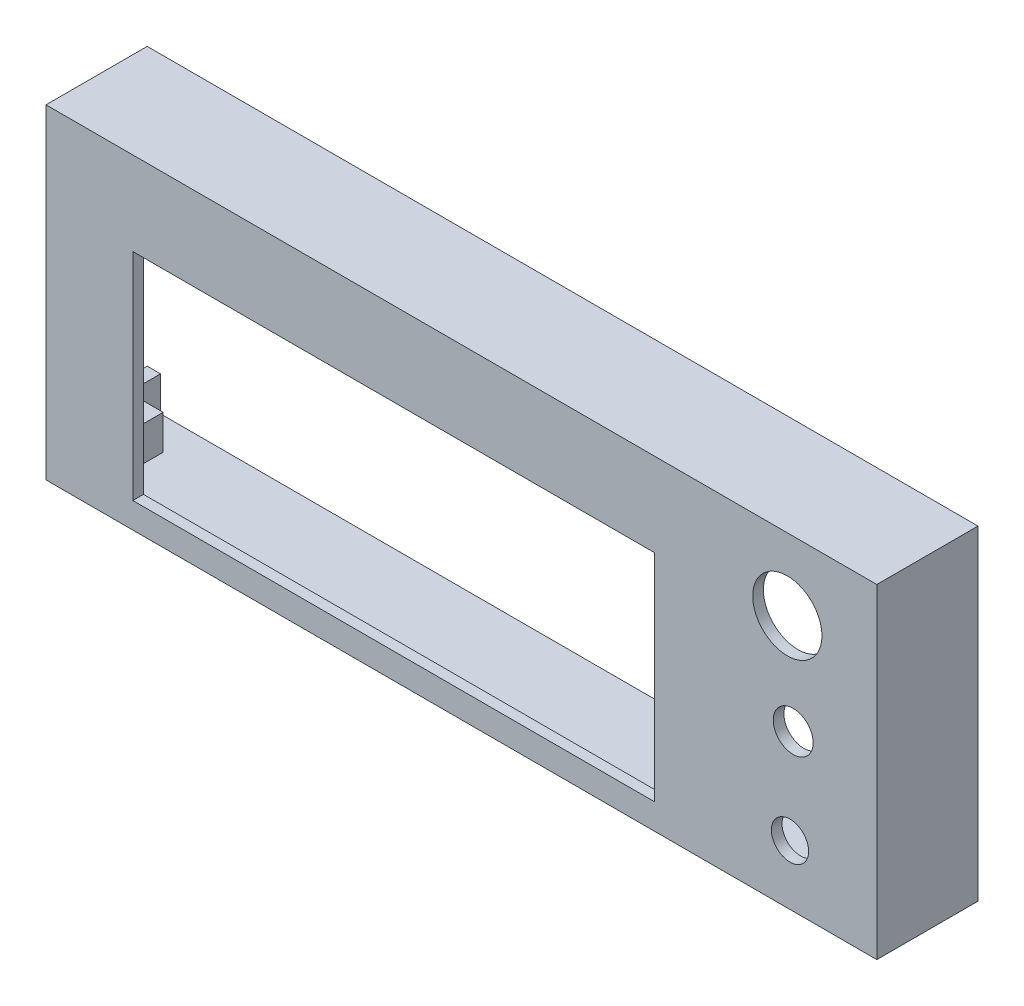
from build123d import *

# Parameters (mm, degrees)
BOSS_EXTRUDE1_DEPTH                                 = 24
SKETCH2_W                                           = 151
SKETCH2_H                                           = 56
CUT_EXTRUDE1_DEPTH                                  = 22
SKETCH3_W                                           = 156
SKETCH3_H                                           = 61
CUT_EXTRUDE2_DEPTH                                  = 5
SKETCH4_R                                           = 6.5
SKETCH4_R_2                                         = 3.75
SKETCH4_R_3                                         = 3.5
SKETCH4_W                                           = 98
SKETCH4_H                                           = 40.5
CUT_EXTRUDE3_DEPTH                                  = 4
CBORE_FOR_M4_HEX_SOCKET_HEAD_CAP_SCREW1_D           = 4.5
CBORE_FOR_M4_HEX_SOCKET_HEAD_CAP_SCREW1_CBORE_D     = 8
CBORE_FOR_M4_HEX_SOCKET_HEAD_CAP_SCREW1_CBORE_DEPTH = 4.4
SKETCH7_W                                           = 6.5
SKETCH7_H                                           = 6.5
BOSS_EXTRUDE2_DEPTH                                 = 11
F_2_0MM_DOWEL_HOLE1_D                               = 2
F_2_0MM_DOWEL_HOLE1_DEPTH                           = 8
F_2_0MM_DOWEL_HOLE1_TIP                             = 0.600860619
SKETCH13_W                                          = 15
SKETCH13_H                                          = 20
CUT_EXTRUDE6_DEPTH                                  = 24
SKETCH14_W                                          = 6
SKETCH14_H                                          = 31
CUT_EXTRUDE7_DEPTH                                  = 3


with BuildPart() as part:
    # Sketch1 → Boss-Extrude1 (new body)
    with BuildSketch(Plane.XY):
        Polygon((-93, 10.5), (-78, 10.5), (-78, -30.5), (78, -30.5), (78, 10.5), (93, 10.5), (93, 30.5), (-93, 30.5), align=None)
    extrude(amount=BOSS_EXTRUDE1_DEPTH)

    # Sketch2 → Cut-Extrude1 (cut)
    with BuildSketch(Plane(origin=(0, 0, 0), x_dir=(-1, 0, 0), z_dir=(0, 0, -1))):
        Rectangle(SKETCH2_W, SKETCH2_H)
    extrude(amount=-CUT_EXTRUDE1_DEPTH, mode=Mode.SUBTRACT)

    # Sketch3 → Cut-Extrude2 (cut)
    with BuildSketch(Plane(origin=(0, 0, 0), x_dir=(-1, 0, 0), z_dir=(0, 0, -1))):
        Rectangle(SKETCH3_W, SKETCH3_H)
    extrude(amount=-CUT_EXTRUDE2_DEPTH, mode=Mode.SUBTRACT)

    # Sketch4 → Cut-Extrude3 (cut)
    with BuildSketch(Plane.XY.offset(24)):
        with Locations((61.2, 17)):
            Circle(SKETCH4_R)
        with Locations((62.3, -1.25)):
            Circle(SKETCH4_R_2)
        with Locations((61.7, -19.3)):
            Circle(SKETCH4_R_3)
        with Locations((-12.7, -5.45)):
            Rectangle(SKETCH4_W, SKETCH4_H)
    extrude(amount=-CUT_EXTRUDE3_DEPTH, mode=Mode.SUBTRACT)

    # CBORE for M4 Hex Socket Head Cap Screw1 (through all)
    with Locations(Plane.XY.offset(24)):
        with Locations((-85, 20.5), (85, 20.376125295)):
            CounterBoreHole(CBORE_FOR_M4_HEX_SOCKET_HEAD_CAP_SCREW1_D / 2, CBORE_FOR_M4_HEX_SOCKET_HEAD_CAP_SCREW1_CBORE_D / 2, CBORE_FOR_M4_HEX_SOCKET_HEAD_CAP_SCREW1_CBORE_DEPTH)

    # Sketch7 → Boss-Extrude2 (add)
    with BuildSketch(Plane(origin=(0, 0, 22), x_dir=(-1, 0, 0), z_dir=(0, 0, -1))):
        with Locations((-72.25, 24.75)):
            Rectangle(SKETCH7_W, SKETCH7_H)
        with Locations((-72.25, -24.75)):
            Rectangle(SKETCH7_W, SKETCH7_H)
        with Locations((72.25, 24.75)):
            Rectangle(SKETCH7_W, SKETCH7_H)
        with Locations((72.25, -24.75)):
            Rectangle(SKETCH7_W, SKETCH7_H)
    extrude(amount=BOSS_EXTRUDE2_DEPTH)

    # Ø2.0mm Dowel Hole1
    with Locations(Plane(origin=(0, 0, 11), x_dir=(-1, 0, 0), z_dir=(0, 0, -1))):
        with Locations((-72.25, 24.75), (-72.25, -24.75), (72.25, 24.75), (72.25, -24.75)):
            Hole(F_2_0MM_DOWEL_HOLE1_D / 2, depth=F_2_0MM_DOWEL_HOLE1_DEPTH)
            with Locations((0, 0, -(F_2_0MM_DOWEL_HOLE1_DEPTH + F_2_0MM_DOWEL_HOLE1_TIP / 2))):  # 118° drill point
                Cone(0, F_2_0MM_DOWEL_HOLE1_D / 2, F_2_0MM_DOWEL_HOLE1_TIP, mode=Mode.SUBTRACT)

    # Sketch13 → Cut-Extrude6 (cut)
    with BuildSketch(Plane(origin=(0, 0, 0), x_dir=(-1, 0, 0), z_dir=(0, 0, -1))):
        with Locations((-85.5, 20.5)):
            Rectangle(SKETCH13_W, SKETCH13_H)
        with Locations((85.5, 20.5)):
            Rectangle(SKETCH13_W, SKETCH13_H)
    extrude(amount=-CUT_EXTRUDE6_DEPTH, mode=Mode.SUBTRACT)

    # Sketch14 → Cut-Extrude7 (cut)
    with BuildSketch(Plane.ZY.offset(78)):
        with Locations((8, -6)):
            Rectangle(SKETCH14_W, SKETCH14_H)
    extrude(amount=-CUT_EXTRUDE7_DEPTH, mode=Mode.SUBTRACT)


solid = part.part
